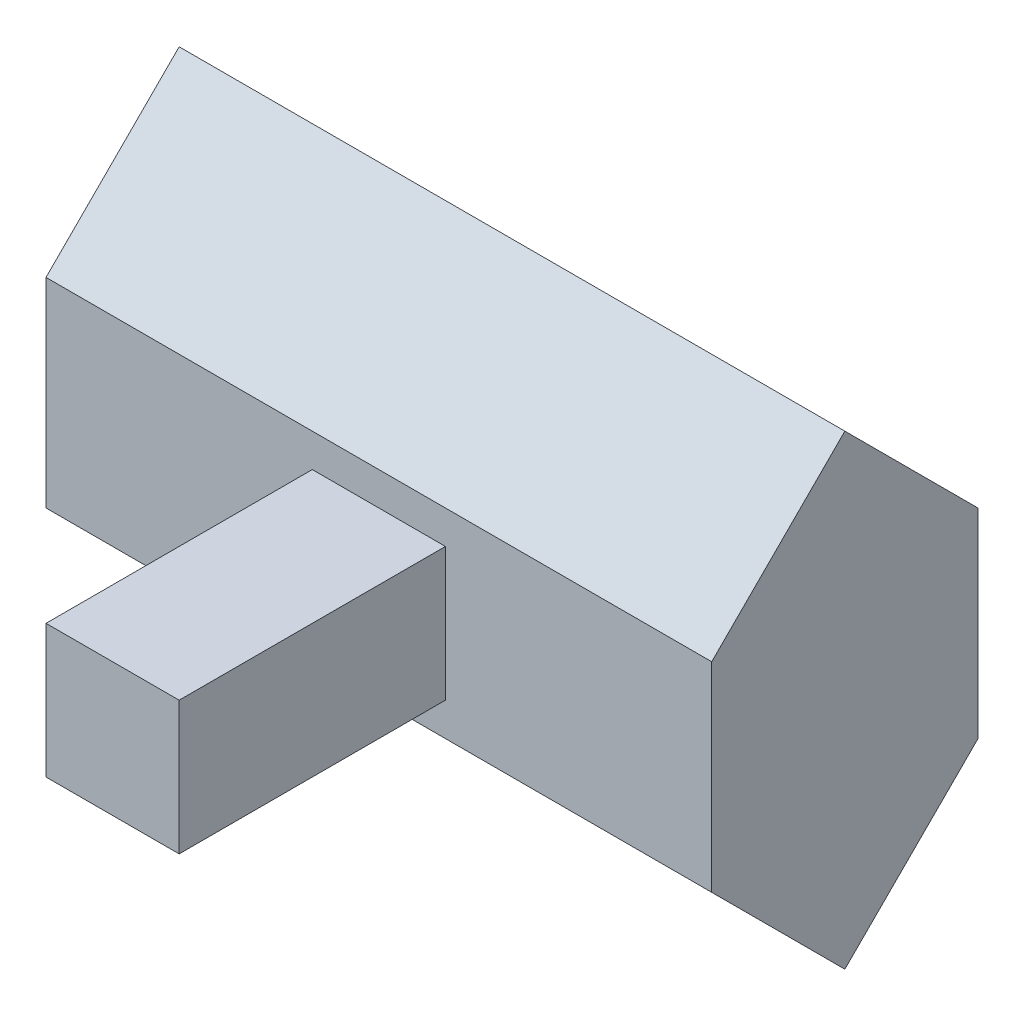
from build123d import *

# Parameters (mm, degrees)
SKETCH1_W           = 500
SKETCH1_H           = 350
BOSS_EXTRUDE1_DEPTH = 200
CHAMFER3_SIZE       = 100
SHELL2_T            = -5
SKETCH3_W           = 100
SKETCH3_H           = 100
BOSS_EXTRUDE3_DEPTH = 200


with BuildPart() as part:
    # Sketch1 → Boss-Extrude1 (new body)
    with BuildSketch(Plane.XY):
        with Locations((250, 175)):
            Rectangle(SKETCH1_W, SKETCH1_H)
    extrude(amount=BOSS_EXTRUDE1_DEPTH)

    # Chamfer3
    chamfer3_edges = [part.edges().sort_by_distance(p)[0] for p in [
        (250, 350, 0),
        (250, 350, 200),
        (250, 0, 0),
        (250, 0, 200),
    ]]
    chamfer(chamfer3_edges, length=CHAMFER3_SIZE - 0.0001)  # a hair under: the kernel refuses the full size

    # Shell2
    shell2_openings = [part.faces().sort_by_distance(p)[0] for p in [
        (250, 175, 0),
    ]]
    offset(amount=SHELL2_T, openings=shell2_openings, kind=Kind.INTERSECTION)

    # Sketch3 → Boss-Extrude3 (add)
    with BuildSketch(Plane.XY.offset(200)):
        with Locations((250, 175)):
            Rectangle(SKETCH3_W, SKETCH3_H)
    extrude(amount=BOSS_EXTRUDE3_DEPTH)


solid = part.part
